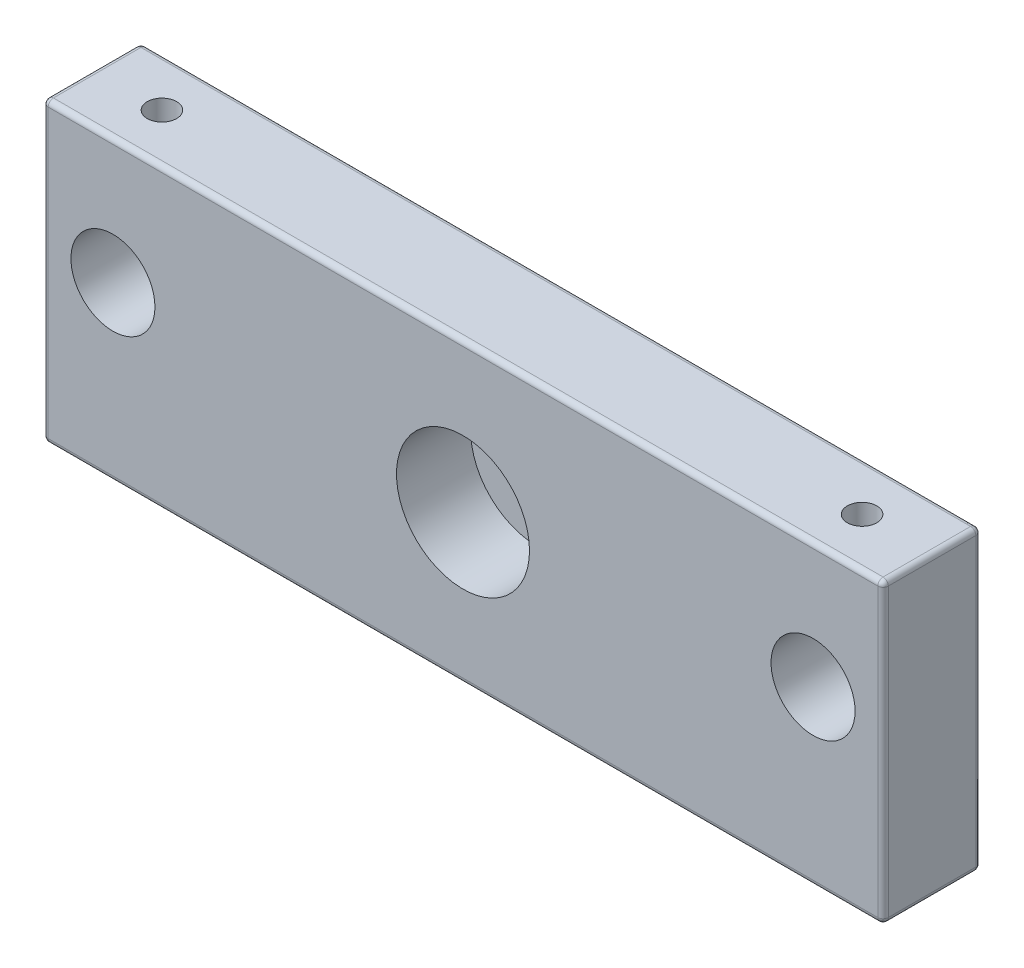
from build123d import *

# Parameters (mm, degrees)
SKETCH1_W           = 120
SKETCH1_H           = 42.5
BOSS_EXTRUDE1_DEPTH = 7
SKETCH2_R           = 9.5
CUT_EXTRUDE1_DEPTH  = 10.6
SKETCH3_R           = 5.5
CUT_EXTRUDE2_DEPTH  = 65.528462712
SKETCH5_R           = 6
CUT_EXTRUDE4_DEPTH  = 66.173326599
SKETCH6_R           = 2.1
SKETCH6_R_2         = 1.25
CUT_EXTRUDE5_DEPTH  = 10
FILLET1_R           = 0.75
CUT_EXTRUDE6_REACH  = 75.86
SKETCH7_R           = 2.1


with BuildPart() as part:
    # Sketch1 → Boss-Extrude1 (new, symmetric)
    with BuildSketch(Plane.XY):
        Rectangle(SKETCH1_W, SKETCH1_H)
    extrude(amount=BOSS_EXTRUDE1_DEPTH, both=True)

    # Sketch2 → Cut-Extrude1 (cut)
    with BuildSketch(Plane.XY.offset(7)):
        Circle(SKETCH2_R)
    extrude(amount=-CUT_EXTRUDE1_DEPTH, mode=Mode.SUBTRACT)

    # Sketch3 → Cut-Extrude2 (cut, through all)
    with BuildSketch(Plane.XY.offset(-3.6)):
        Circle(SKETCH3_R)
    extrude(amount=-CUT_EXTRUDE2_DEPTH, mode=Mode.SUBTRACT)

    # Sketch5 → Cut-Extrude4 (cut, through all)
    with BuildSketch(Plane.XY.offset(7)):
        with Locations((-50, 3.4)):
            Circle(SKETCH5_R)
        with Locations((50, 3.4)):
            Circle(SKETCH5_R)
    extrude(amount=-CUT_EXTRUDE4_DEPTH, mode=Mode.SUBTRACT)

    # Sketch6 → Cut-Extrude5 (cut)
    with BuildSketch(Plane.XZ.offset(21.25)):
        with Locations((-50, 0)):
            Circle(SKETCH6_R)
        with Locations((-25, 0)):
            Circle(SKETCH6_R)
        with Locations((25, 0)):
            Circle(SKETCH6_R)
        with Locations((50, 0)):
            Circle(SKETCH6_R)
        with Locations((-37.5, 0)):
            Circle(SKETCH6_R_2)
        with Locations((37.5, 0)):
            Circle(SKETCH6_R_2)
    extrude(amount=-CUT_EXTRUDE5_DEPTH, mode=Mode.SUBTRACT)

    # Fillet1
    fillet1_edges = [part.edges().sort_by_distance(p)[0] for p in [
        (60, 21.25, 0),
        (60, 0, -7),
        (0, 21.25, -7),
        (60, 0, 7),
        (60, -21.25, 0),
        (0, -21.25, -7),
        (0, 21.25, 7),
        (-60, 21.25, 0),
        (-60, 0, -7),
        (0, -21.25, 7),
        (-60, -21.25, 0),
        (-60, 0, 7),
    ]]
    fillet(fillet1_edges, radius=FILLET1_R)

    # Sketch7 → Cut-Extrude6 (cut, up to next)
    with BuildSketch(Plane(origin=(0, 21.25, 0), x_dir=(1, 0, 0), z_dir=(0, 1, 0)), mode=Mode.PRIVATE) as cut_extrude6_sk1:
        with Locations((-50, 0)):
            Circle(SKETCH7_R)
    cut_extrude6_tool1 = extrude(cut_extrude6_sk1.sketch, amount=-CUT_EXTRUDE6_REACH, mode=Mode.PRIVATE) & part.part
    # Sketch7 → Cut-Extrude6 (cut, up to next)
    with BuildSketch(Plane(origin=(0, 21.25, 0), x_dir=(1, 0, 0), z_dir=(0, 1, 0)), mode=Mode.PRIVATE) as cut_extrude6_sk2:
        with Locations((50, 0)):
            Circle(SKETCH7_R)
    cut_extrude6_tool2 = extrude(cut_extrude6_sk2.sketch, amount=-CUT_EXTRUDE6_REACH, mode=Mode.PRIVATE) & part.part
    add(cut_extrude6_tool1.solids().sort_by_distance((-50, 21.25, 0))[0], mode=Mode.SUBTRACT)
    add(cut_extrude6_tool2.solids().sort_by_distance((50, 21.25, 0))[0], mode=Mode.SUBTRACT)


solid = part.part
